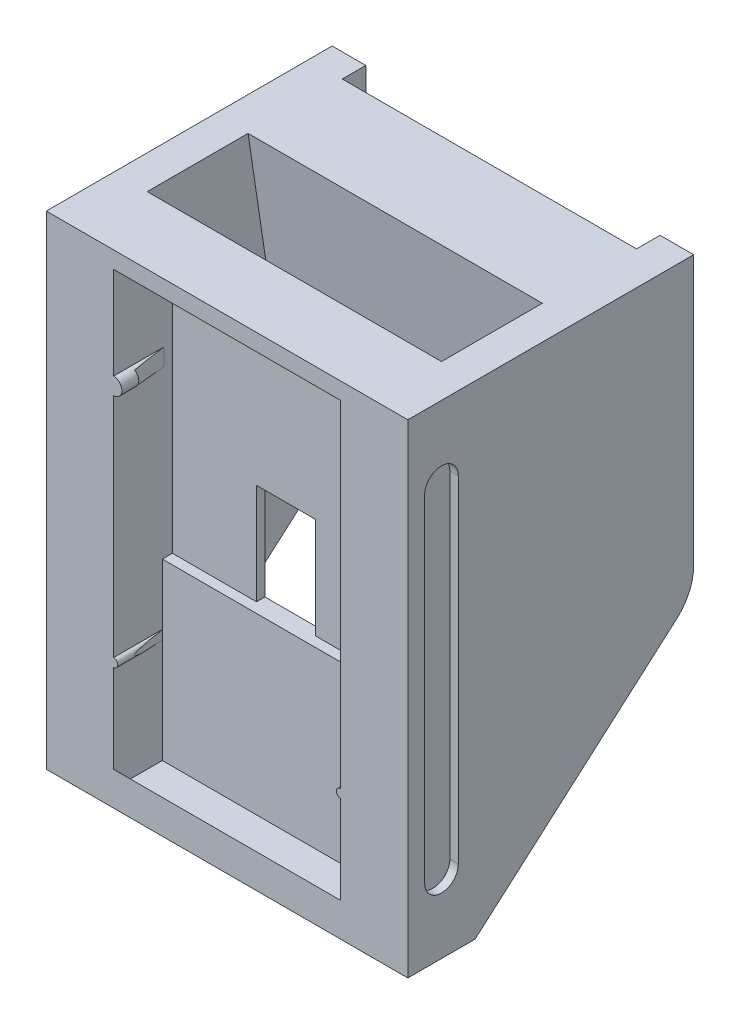
from build123d import *

# Parameters (mm, degrees)
BOSS_EXTRUDE2_DEPTH = 0.5
BOSS_EXTRUDE3_DEPTH = 0.6
SKETCH4_W           = 21.5
SKETCH4_H           = 28.75
SKETCH4_W_2         = 13.5
SKETCH4_H_2         = 26.75
BOSS_EXTRUDE4_DEPTH = 3
SKETCH5_W           = 21.5
SKETCH5_H           = 28.75
BOSS_EXTRUDE5_DEPTH = 1
CHAMFER1_SIZE       = 0.25
CHAMFER1_SIZE_2     = 2
CHAMFER2_SIZE       = 2
CUT_EXTRUDE3_DEPTH  = 0.5
BOSS_EXTRUDE6_DEPTH = 2
BOSS_EXTRUDE8_START = -2
BOSS_EXTRUDE8_DEPTH = 17.5


with BuildPart() as part:
    # Sketch2 → Boss-Extrude2 (new body)
    with BuildSketch(Plane.XY):
        Polygon((-6.75, 13.375), (-6.75, -3), (-1.75, -3), (-1.75, 3), (1.75, 3), (1.75, -3), (6.75, -3), (6.75, 13.375), align=None)
        Polygon((-6.75, -3), (-6.75, -13.375), (6.75, -13.375), (6.75, -3), (1.75, -3), (-1.75, -3), align=None)
    extrude(amount=-BOSS_EXTRUDE2_DEPTH)

    # Sketch2<5> → Boss-Extrude3 (add)
    with BuildSketch(Plane.XY):
        Polygon((-6.75, -3), (-6.75, -13.375), (6.75, -13.375), (6.75, -3), (1.75, -3), (-1.75, -3), align=None)
    extrude(amount=BOSS_EXTRUDE3_DEPTH)

    # Sketch4 → Boss-Extrude4 (add)
    with BuildSketch(Plane(origin=(0, 0, -0.5), x_dir=(-1, 0, 0), z_dir=(0, 0, -1))):
        Rectangle(SKETCH4_W, SKETCH4_H)
        Rectangle(SKETCH4_W_2, SKETCH4_H_2, mode=Mode.SUBTRACT)
    extrude(amount=-BOSS_EXTRUDE4_DEPTH)

    # Sketch5 → Boss-Extrude5 (add)
    with BuildSketch(Plane.XY.offset(2.5)):
        Rectangle(SKETCH5_W, SKETCH5_H)
        with BuildLine():
            Line((-6.75, -7.125), (-6.75, -11.375))
            Line((-6.75, -11.375), (6.75, -11.375))
            Line((6.75, -11.375), (6.75, -7.125))
            ThreePointArc((6.75, -7.125), (6.5, -6.875), (6.75, -6.625))
            Line((6.75, -6.625), (6.75, 13.375))
            Line((6.75, 13.375), (-6.75, 13.375))
            Line((-6.75, 13.375), (-6.75, 7.875))
            ThreePointArc((-6.75, 7.875), (-6.25, 7.375), (-6.75, 6.875))
            Line((-6.75, 6.875), (-6.75, -6.625))
            ThreePointArc((-6.75, -6.625), (-6.5, -6.875), (-6.75, -7.125))
        make_face(mode=Mode.SUBTRACT)
    extrude(amount=BOSS_EXTRUDE5_DEPTH)

    # Chamfer1
    # the kernel refuses this chamfer: 2, 0.25 mm, written as the material it adds along each edge
    with BuildSketch(Plane(origin=(6.75, -1.426485236, 2.5), x_dir=(-0.9563912737708581, 0, 0.29208856782653414), z_dir=(0, -1, 0))) as chamfer1_piece_1_section:
        Polygon((CHAMFER1_SIZE * 0.956391273771, CHAMFER1_SIZE * 0.292088567827), (-CHAMFER1_SIZE_2 * 0.292088567827, CHAMFER1_SIZE_2 * 0.956391273771), (0, 0), align=None)
    chamfer1_piece_1 = extrude(amount=10.897029528, mode=Mode.PRIVATE)
    chamfer1_piece_1 = chamfer1_piece_1 & Plane(origin=(6.75, -6.875, 1.806445447), x_dir=(0, -1, 0), z_dir=(0, 0, -1)) * Cylinder(0.25, 30, mode=Mode.PRIVATE)
    add(chamfer1_piece_1)
    with BuildSketch(Plane(origin=(-6.75, -12.323514764, 2.5), x_dir=(-0.0047719296843702665, 0, -0.9999886142787264), z_dir=(0, 1, 0))) as chamfer1_piece_2_section:
        Polygon((CHAMFER1_SIZE_2 * 0.999988614279, -CHAMFER1_SIZE_2 * 0.00477192968437), (-CHAMFER1_SIZE * 0.00477192968437, -CHAMFER1_SIZE * 0.999988614279), (0, 0), align=None)
    chamfer1_piece_2 = extrude(amount=10.897029528, mode=Mode.PRIVATE)
    chamfer1_piece_2 = chamfer1_piece_2 & Plane(origin=(-6.75, -6.875, 1.806445447), x_dir=(0, 1, 0), z_dir=(0, 0, -1)) * Cylinder(0.25, 30, mode=Mode.PRIVATE)
    add(chamfer1_piece_2)
    with BuildSketch(Plane(origin=(-6.75, 1.676485236, 2.5), x_dir=(0.9563912737708581, 0, 0.29208856782653414), z_dir=(0, 1, 0))) as chamfer1_piece_3_section:
        Polygon((CHAMFER1_SIZE * 0.956391273771, CHAMFER1_SIZE * 0.292088567827), (-CHAMFER1_SIZE_2 * 0.292088567827, CHAMFER1_SIZE_2 * 0.956391273771), (0, 0), align=None)
    chamfer1_piece_3 = extrude(amount=11.397029528, mode=Mode.PRIVATE)
    chamfer1_piece_3 = chamfer1_piece_3 & Plane(origin=(-6.75, 7.375, 1.827435812), x_dir=(0, 1, 0), z_dir=(0, 0, -1)) * Cylinder(0.5, 31, mode=Mode.PRIVATE)
    add(chamfer1_piece_3)

    # Chamfer2
    # the kernel refuses this chamfer: 2 mm, written as the material it takes off along each edge
    with BuildSketch(Plane(origin=(-6.75, -11.375, 2.5), x_dir=(0, -0.9996219169112968, -0.02749587661058627), z_dir=(1, 0, 0))) as chamfer2_piece_1_section:
        Polygon((CHAMFER2_SIZE * 0.999621916911, -CHAMFER2_SIZE * 0.0274958766106), (-CHAMFER2_SIZE * 0.0274958766106, -CHAMFER2_SIZE * 0.999621916911), (0, 0), align=None)
    chamfer2_piece_1 = extrude(amount=13.5, mode=Mode.PRIVATE)
    chamfer2_piece_1 = split(chamfer2_piece_1, bisect_by=Plane(origin=(0, -13.375, 3.160808309), z_dir=(0, 1, 0)), keep=Keep.TOP, mode=Mode.PRIVATE)
    add(chamfer2_piece_1, mode=Mode.SUBTRACT)

    # Sketch7 → Cut-Extrude3 (cut)
    with BuildSketch(Plane(origin=(10.75, 0, 0), x_dir=(0, 0, -1), z_dir=(1, 0, 0))):
        with BuildLine():
            Line((-0.5, 10), (-0.5, -10))
            ThreePointArc((-0.5, -10), (-1.5, -11), (-2.5, -10))
            Line((-2.5, -10), (-2.5, 10))
            ThreePointArc((-2.5, 10), (-1.5, 11), (-0.5, 10))
        make_face()
    cut_extrude3 = extrude(amount=-CUT_EXTRUDE3_DEPTH, mode=Mode.SUBTRACT)

    # Sketch8 → Boss-Extrude6 (add)
    with BuildSketch(Plane(origin=(10.75, 0, 0), x_dir=(0, 0, -1), z_dir=(1, 0, 0))):
        with BuildLine():
            Line((0.5, 14.375), (0.5, -14.375))
            Line((0.5, -14.375), (12.476974843, -3.881450857))
            ThreePointArc((12.476974843, -3.881450857), (13.232299812, -2.863764601), (13.5, -1.625))
            Line((13.5, -1.625), (13.5, 14.375))
            Line((13.5, 14.375), (0.5, 14.375))
        make_face()
    boss_extrude6 = extrude(amount=-BOSS_EXTRUDE6_DEPTH)

    # Mirror1: Cut-Extrude3, Boss-Extrude6 across plane
    add(cut_extrude3.mirror(Plane(origin=(0, 0, 0), x_dir=(0, 0, 1), z_dir=(1, 0, 0))), mode=Mode.SUBTRACT)
    add(boss_extrude6.mirror(Plane(origin=(0, 0, 0), x_dir=(0, 0, 1), z_dir=(1, 0, 0))))

    # Sketch8<3> → Boss-Extrude8 (add)
    with BuildSketch(Plane(origin=(10.75, 0, 0), x_dir=(0, 0, -1), z_dir=(1, 0, 0)).offset(BOSS_EXTRUDE8_START)):
        with BuildLine():
            Line((12.1, 14.375), (6.5, 14.375))
            Line((6.5, 14.375), (8.917446812, -1.860638297))
            ThreePointArc((8.917446812, -1.860638297), (10.61814165, -3.220632336), (12.1, -1.625))
            Line((12.1, -1.625), (12.1, 14.375))
        make_face()
    extrude(amount=-BOSS_EXTRUDE8_DEPTH)


solid = part.part
